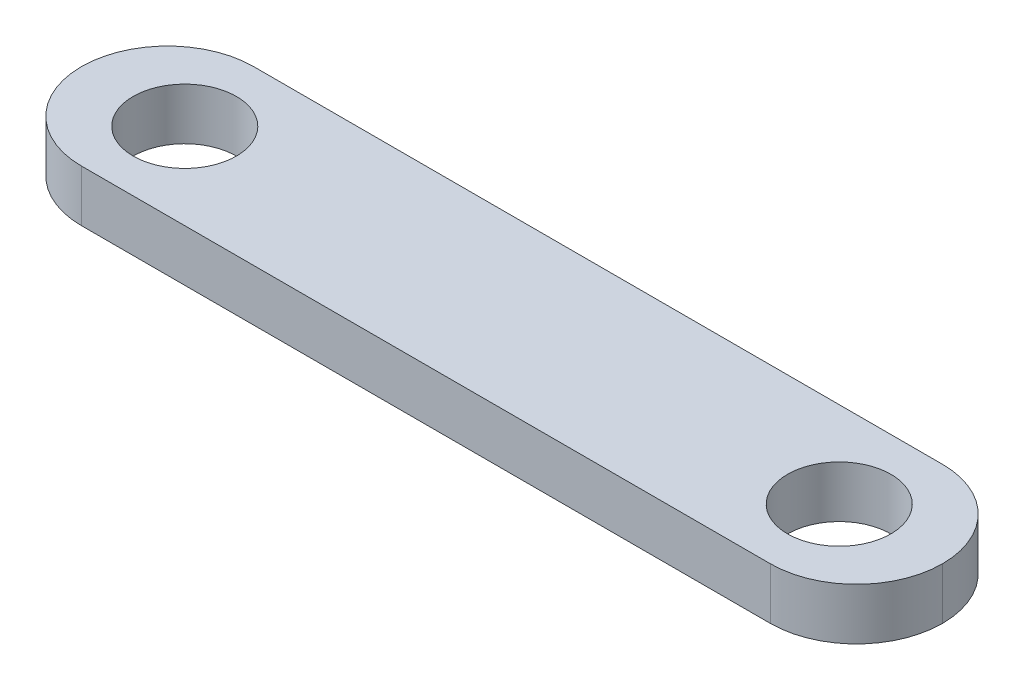
from build123d import *

# Parameters (mm, degrees)
SKETCH2_W           = 50
SKETCH2_H           = 10
BOSS_EXTRUDE1_DEPTH = 3
FILLET1_R           = 5
FILLET2_R           = 5
SKETCH9_R           = 3
CUT_EXTRUDE2_DEPTH  = 52.078371156
SKETCH10_R          = 3
CUT_EXTRUDE3_DEPTH  = 52.078371156


with BuildPart() as part:
    # Sketch2 → Boss-Extrude1 (new body)
    with BuildSketch(Plane(origin=(0, 0, 0), x_dir=(1, 0, 0), z_dir=(0, 1, 0))):
        with Locations((25, 5)):
            Rectangle(SKETCH2_W, SKETCH2_H)
    extrude(amount=BOSS_EXTRUDE1_DEPTH)

    # Fillet1
    fillet1_edges = [part.edges().sort_by_distance(p)[0] for p in [
        (0, 1.5, -10),
        (0, 1.5, 0),
    ]]
    fillet(fillet1_edges, radius=FILLET1_R - 0.0001)  # a hair under: the kernel refuses the full size

    # Fillet2
    fillet2_edges = [part.edges().sort_by_distance(p)[0] for p in [
        (50, 1.5, -10),
        (50, 1.5, 0),
    ]]
    fillet(fillet2_edges, radius=FILLET2_R - 0.0001)  # a hair under: the kernel refuses the full size

    # Sketch9 → Cut-Extrude2 (cut, through all)
    with BuildSketch(Plane(origin=(0, 3, 0), x_dir=(1, 0, 0), z_dir=(0, 1, 0))):
        with Locations(Location((6, 5, 0), (0, 0, 270))):
            Circle(SKETCH9_R)
    extrude(amount=-CUT_EXTRUDE2_DEPTH, mode=Mode.SUBTRACT)

    # Sketch10 → Cut-Extrude3 (cut, through all)
    with BuildSketch(Plane(origin=(0, 3, 0), x_dir=(1, 0, 0), z_dir=(0, 1, 0))):
        with Locations(Location((44, 5, 0), (0, 0, 270))):
            Circle(SKETCH10_R)
    extrude(amount=-CUT_EXTRUDE3_DEPTH, mode=Mode.SUBTRACT)


solid = part.part
